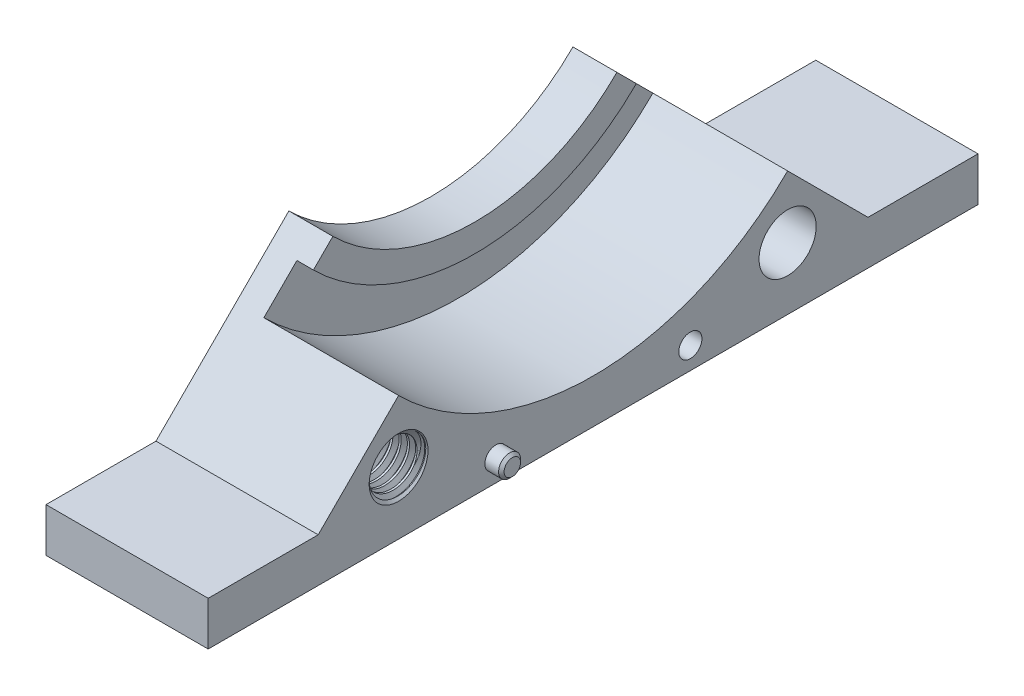
from build123d import *

# Parameters (mm, degrees)
BOSS_EXTRUDE2_DEPTH = 29.5
BOSS_EXTRUDE3_DEPTH = 5
BOSS_EXTRUDE4_DEPTH = 8
SKETCH2_R           = 5.2
SKETCH2_R_2         = 4.35
CUT_EXTRUDE1_DEPTH  = 20
SKETCH2_2_R         = 5.2
CUT_EXTRUDE2_DEPTH  = 115.47420654
SKETCH2_3_R         = 2
BOSS_EXTRUDE5_DEPTH = 3
SKETCH2_5_R         = 2.1
CUT_EXTRUDE9_DEPTH  = 4
CHAMFER1_SIZE       = 0.5
CHAMFER2_SIZE       = 1
THREAD3_PITCH       = 1.5


with BuildPart() as part:
    # Sketch1 → Boss-Extrude2 (new body)
    with BuildSketch(Plane(origin=(0, 0, 0), x_dir=(0, 0, -1), z_dir=(1, 0, 0))):
        with BuildLine():
            Line((-87.588277692, -59.54544821), (-87.588277692, -67.54544821))
            Line((-87.588277692, -67.54544821), (52.411722308, -67.54544821))
            Line((52.411722308, -67.54544821), (52.411722308, -59.54544821))
            Line((52.411722308, -59.54544821), (32.411722308, -59.54544821))
            Line((32.411722308, -59.54544821), (17.78773676, -44.921462663))
            ThreePointArc((17.78773676, -44.921462663), (-17.588277692, -59.54544821), (-52.964292145, -44.921462663))
            Line((-52.964292145, -44.921462663), (-67.588277692, -59.54544821))
            Line((-67.588277692, -59.54544821), (-87.588277692, -59.54544821))
        make_face()
    extrude(amount=BOSS_EXTRUDE2_DEPTH)

    # Sketch1<3> → Boss-Extrude3 (add)
    with BuildSketch(Plane(origin=(0, 0, 0), x_dir=(0, 0, -1), z_dir=(1, 0, 0))):
        with BuildLine():
            Line((-46.953877295, -38.911047813), (-52.964292145, -44.921462663))
            ThreePointArc((-52.964292145, -44.921462663), (-17.588277692, -59.54544821), (17.78773676, -44.921462663))
            Line((17.78773676, -44.921462663), (11.777321911, -38.911047813))
            ThreePointArc((11.777321911, -38.911047813), (-17.588277692, -51.04544821), (-46.953877295, -38.911047813))
        make_face()
    extrude(amount=BOSS_EXTRUDE3_DEPTH)

    # Sketch1<4> → Boss-Extrude4 (add)
    with BuildSketch(Plane(origin=(0, 0, 0), x_dir=(0, 0, -1), z_dir=(1, 0, 0))):
        with BuildLine():
            Line((-43.418337584, -35.375508102), (-46.953877295, -38.911047813))
            ThreePointArc((-46.953877295, -38.911047813), (-17.588277692, -51.04544821), (11.777321911, -38.911047813))
            Line((11.777321911, -38.911047813), (8.241782199, -35.375508102))
            ThreePointArc((8.241782199, -35.375508102), (-17.588277692, -46.04544821), (-43.418337584, -35.375508102))
        make_face()
    extrude(amount=BOSS_EXTRUDE4_DEPTH)

    # Sketch2 → Cut-Extrude1 (cut)
    with BuildSketch(Plane(origin=(29.5, 0, 0), x_dir=(0, 0, -1), z_dir=(1, 0, 0))):
        with Locations((17.78773676, -56.233455436)):
            Circle(SKETCH2_R)
        with Locations((-52.964292145, -56.233455436)):
            Circle(SKETCH2_R_2)
    extrude(amount=-CUT_EXTRUDE1_DEPTH, mode=Mode.SUBTRACT)

    # Sketch2<2> → Cut-Extrude2 (cut, through all)
    with BuildSketch(Plane(origin=(29.5, 0, 0), x_dir=(0, 0, -1), z_dir=(1, 0, 0))):
        with Locations((17.78773676, -56.233455436)):
            Circle(SKETCH2_2_R)
    extrude(amount=-CUT_EXTRUDE2_DEPTH, mode=Mode.SUBTRACT)

    # Sketch2<5> → Cut-Extrude9 (cut)
    with BuildSketch(Plane(origin=(29.5, 0, 0), x_dir=(0, 0, -1), z_dir=(1, 0, 0))):
        with Locations((0.099729534, -63.54544821)):
            Circle(SKETCH2_5_R)
    extrude(amount=-CUT_EXTRUDE9_DEPTH, mode=Mode.SUBTRACT)

    # Chamfer2
    chamfer2_edges = [part.edges().sort_by_distance(p)[0] for p in [
        (29.5, -56.233455436, 57.314292145),
    ]]
    chamfer(chamfer2_edges, length=CHAMFER2_SIZE)

    # Thread3: the profile of Thread Profile3 profile screwed along a right-hand helix of 17.333333 turns, 8 arcs to a turn; built about Z, then put on its axis
    thread3_z = Axis((0, 0, 0), (0, 0, 1))
    thread3_corners = [(4.3497, 0, -0.000173205), (5.161898813, 0, 0.468749998), (5.161898813, 0, 0.656249998), (4.3497, 0, 1.125173201)]
    with BuildLine(mode=Mode.PRIVATE) as thread3_profile:
        Line(thread3_corners[0], thread3_corners[1])
        Line(thread3_corners[1], thread3_corners[2])
        Line(thread3_corners[2], thread3_corners[3])
        Line(thread3_corners[3], thread3_corners[0])
    thread3_cap = Face(thread3_profile.wire())
    thread3_turn_angles = [0, 22.5, 45, 67.5, 90, 112.5, 135, 157.5, 180, 202.5, 225, 247.5, 270, 292.5, 315, 337.5, 360]
    thread3_turn_weights = [1, 0.9238795325112867, 1, 0.9238795325112867, 1, 0.9238795325112867, 1, 0.9238795325112867, 1, 0.9238795325112867, 1, 0.9238795325112867, 1, 0.9238795325112867, 1, 0.9238795325112867, 1]
    thread3_turn_rails = [Edge.make_bspline([Vector(p[0], p[1], 0).rotate(thread3_z, thread3_turn_angles[k]) / thread3_turn_weights[k] + Vector(0, 0, p[2] + THREAD3_PITCH * thread3_turn_angles[k] / 360) for k in range(17)], [0, 0, 0, 1, 1, 2, 2, 3, 3, 4, 4, 5, 5, 6, 6, 7, 7, 8, 8, 8], 2, thread3_turn_weights) for p in thread3_corners]
    thread3_turn_sides = [Face.make_surface_from_curves(thread3_turn_rails[p[0]], thread3_turn_rails[p[1]]) for p in [(0, 1), (1, 2), (2, 3), (3, 0)]]
    thread3_last_angles = [6120, 6142.5, 6165, 6187.5, 6210, 6225, 6240]
    thread3_last_weights = [1, 0.9238795325112867, 1, 0.9238795325112867, 1, 0.9659258262890703, 1]
    thread3_last_rails = [Edge.make_bspline([Vector(p[0], p[1], 0).rotate(thread3_z, thread3_last_angles[k]) / thread3_last_weights[k] + Vector(0, 0, p[2] + THREAD3_PITCH * thread3_last_angles[k] / 360) for k in range(7)], [0, 0, 0, 1, 1, 2, 2, 3, 3, 3], 2, thread3_last_weights) for p in thread3_corners]
    thread3_last_sides = [Face.make_surface_from_curves(thread3_last_rails[p[0]], thread3_last_rails[p[1]]) for p in [(0, 1), (1, 2), (2, 3), (3, 0)]]
    thread3 = Plane(origin=(30.5, -56.233455436, 52.964292145), x_dir=(0, 0, 1), z_dir=(-1, 0, 0)) * Solid(Shell([*[p.moved(Location((0, 0, THREAD3_PITCH * i))) for i in range(17) for p in thread3_turn_sides], *thread3_last_sides, thread3_cap, thread3_cap.rotate(thread3_z, 6240).moved(Location((0, 0, THREAD3_PITCH * 6240 / 360)))]))
    add(thread3, mode=Mode.SUBTRACT)


with BuildPart() as body_2:
    # Sketch2<3> → Boss-Extrude5 (new body)
    with BuildSketch(Plane(origin=(29.5, 0, 0), x_dir=(0, 0, -1), z_dir=(1, 0, 0))):
        with Locations((-35.276284919, -63.54544821)):
            Circle(SKETCH2_3_R)
    extrude(amount=BOSS_EXTRUDE5_DEPTH)

    # Chamfer1
    chamfer1_edges = [body_2.edges().sort_by_distance(p)[0] for p in [
        (32.5, -63.54544821, 37.276284919),
    ]]
    chamfer(chamfer1_edges, length=CHAMFER1_SIZE)


solid = Compound([part.part, body_2.part])
